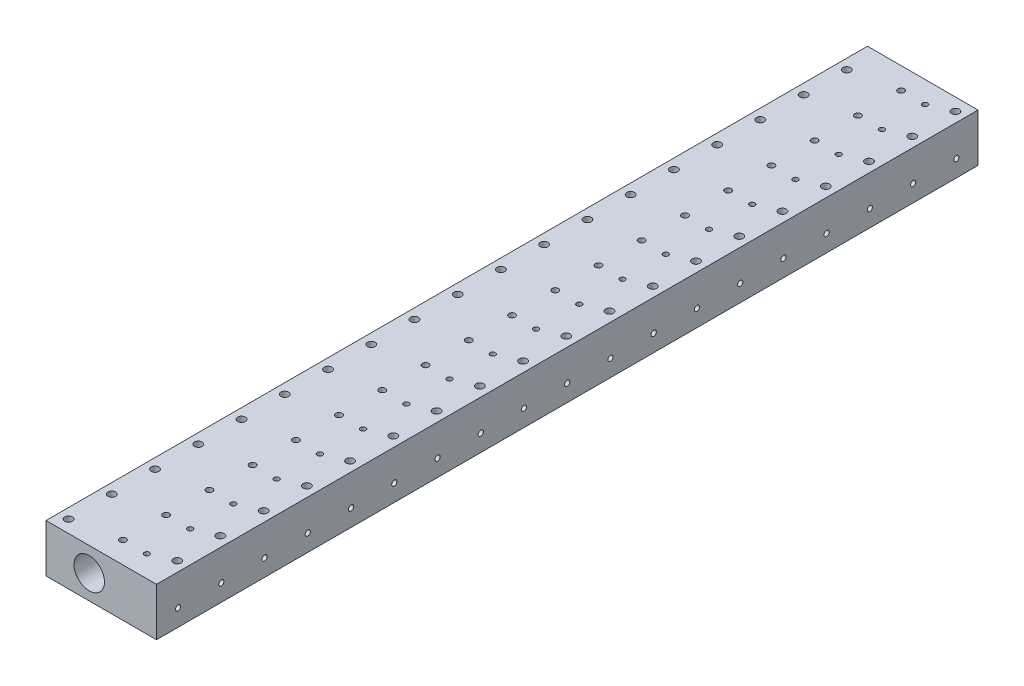
from build123d import *

# Parameters (mm, degrees)
SKETCH1_W                      = 23
SKETCH1_H                      = 10
BOSS_EXTRUDE1_DEPTH            = 171
SKETCH5_R                      = 3.175
CUT_EXTRUDE1_DEPTH             = 172.459178815
M2X0_4_TAPPED_HOLE1_AT_2_COUNT = 2
M2X0_4_TAPPED_HOLE1_AT_2_PITCH = 19.180198122
LPATTERN1_COUNT                = 19
LPATTERN1_PITCH                = 9


with BuildPart() as part:
    # Sketch1 → Boss-Extrude1 (new body)
    with BuildSketch(Plane.XY):
        Rectangle(SKETCH1_W, SKETCH1_H)
    extrude(amount=-BOSS_EXTRUDE1_DEPTH)

    # Sketch4 → #55 (0.052) Diameter Hole1 (revolve, cut)
    with BuildSketch(Plane(origin=(0, 5, -4.5), x_dir=(0, 0, 1), z_dir=(1, 0, 0))):
        Polygon((0, 0), (0, 7.396808353), (0.6604, 7), (0.6604, 0), align=None)
    f_55_0_052_diameter_hole1 = revolve(axis=Axis((0, 11.35, -4.5), (0, -1, 0)), mode=Mode.SUBTRACT)

    # Sketch5 → Cut-Extrude1 (cut, through all)
    with BuildSketch(Plane.XY):
        with Locations((-2.5, 0)):
            Circle(SKETCH5_R)
    extrude(amount=-CUT_EXTRUDE1_DEPTH, mode=Mode.SUBTRACT)

    # Sketch8 → M2x0.4 Tapped Hole1 (revolve, cut)
    with BuildSketch(Plane(origin=(9.4, 5, -6.4), x_dir=(0, 0, 1), z_dir=(1, 0, 0))):
        Polygon((0, 0), (0, 5.680688495), (0.8, 5.2), (0.8, 0), align=None)
    m2x0_4_tapped_hole1 = revolve(axis=Axis((9.4, 11.35, -6.4), (0, -1, 0)), mode=Mode.SUBTRACT)

    # M2x0.4 Tapped Hole1 at 2: M2x0.4 Tapped Hole1 ×2
    with Locations(*[Vector(-0.9801775706589259, 0, 0.1981209983246765) * (i * M2X0_4_TAPPED_HOLE1_AT_2_PITCH) for i in range(1, M2X0_4_TAPPED_HOLE1_AT_2_COUNT)]):
        add(m2x0_4_tapped_hole1, mode=Mode.SUBTRACT)

    # Sketch12 → #57 (0.043) Diameter Hole2 (revolve, cut)
    with BuildSketch(Plane(origin=(11.5, -1.5, -4.5), x_dir=(0, 0, -1), z_dir=(0, 1, 0))):
        Polygon((0, 0), (0, 6.328129984), (0.5461, 6), (0.5461, 0), align=None)
    f_57_0_043_diameter_hole2 = revolve(axis=Axis((17.85, -1.5, -4.5), (-1, 0, 0)), mode=Mode.SUBTRACT)

    # Sketch14 → #57 (0.043) Diameter Hole1 (revolve, cut)
    with BuildSketch(Plane(origin=(5, 5, -4.5), x_dir=(0, 0, 1), z_dir=(1, 0, 0))):
        Polygon((0, 0), (0, 7.828129984), (0.5461, 7.5), (0.5461, 0), align=None)
    f_57_0_043_diameter_hole1 = revolve(axis=Axis((5, 11.35, -4.5), (0, -1, 0)), mode=Mode.SUBTRACT)

    # LPattern1: #55 (0.052) Diameter Hole1, M2x0.4 Tapped Hole1, #57 (0.043) Diameter Hole2, #57 (0.043) Diameter Hole1 ×19
    with Locations(*[(0, 0, -i * LPATTERN1_PITCH) for i in range(1, LPATTERN1_COUNT)]):
        add(f_55_0_052_diameter_hole1, mode=Mode.SUBTRACT)
        add(m2x0_4_tapped_hole1, mode=Mode.SUBTRACT)
        add(f_57_0_043_diameter_hole2, mode=Mode.SUBTRACT)
        add(f_57_0_043_diameter_hole1, mode=Mode.SUBTRACT)

    # LPattern1 copy 1 sketch → LPattern1 copy 1 (revolve, cut)
    with BuildSketch(Plane(origin=(-9.4, 5, -11.6), x_dir=(0, 0, 1), z_dir=(1, 0, 0))):
        Polygon((0, 0), (0, 5.680688495), (0.8, 5.2), (0.8, 0), align=None)
    revolve(axis=Axis((-9.4, 11.35, -11.6), (0, -1, 0)), mode=Mode.SUBTRACT)

    # LPattern1 copy 2 sketch → LPattern1 copy 2 (revolve, cut)
    with BuildSketch(Plane(origin=(-9.4, 5, -20.6), x_dir=(0, 0, 1), z_dir=(1, 0, 0))):
        Polygon((0, 0), (0, 5.680688495), (0.8, 5.2), (0.8, 0), align=None)
    revolve(axis=Axis((-9.4, 11.35, -20.6), (0, -1, 0)), mode=Mode.SUBTRACT)

    # LPattern1 copy 3 sketch → LPattern1 copy 3 (revolve, cut)
    with BuildSketch(Plane(origin=(-9.4, 5, -29.6), x_dir=(0, 0, 1), z_dir=(1, 0, 0))):
        Polygon((0, 0), (0, 5.680688495), (0.8, 5.2), (0.8, 0), align=None)
    revolve(axis=Axis((-9.4, 11.35, -29.6), (0, -1, 0)), mode=Mode.SUBTRACT)

    # LPattern1 copy 4 sketch → LPattern1 copy 4 (revolve, cut)
    with BuildSketch(Plane(origin=(-9.4, 5, -38.6), x_dir=(0, 0, 1), z_dir=(1, 0, 0))):
        Polygon((0, 0), (0, 5.680688495), (0.8, 5.2), (0.8, 0), align=None)
    revolve(axis=Axis((-9.4, 11.35, -38.6), (0, -1, 0)), mode=Mode.SUBTRACT)

    # LPattern1 copy 5 sketch → LPattern1 copy 5 (revolve, cut)
    with BuildSketch(Plane(origin=(-9.4, 5, -47.6), x_dir=(0, 0, 1), z_dir=(1, 0, 0))):
        Polygon((0, 0), (0, 5.680688495), (0.8, 5.2), (0.8, 0), align=None)
    revolve(axis=Axis((-9.4, 11.35, -47.6), (0, -1, 0)), mode=Mode.SUBTRACT)

    # LPattern1 copy 6 sketch → LPattern1 copy 6 (revolve, cut)
    with BuildSketch(Plane(origin=(-9.4, 5, -56.6), x_dir=(0, 0, 1), z_dir=(1, 0, 0))):
        Polygon((0, 0), (0, 5.680688495), (0.8, 5.2), (0.8, 0), align=None)
    revolve(axis=Axis((-9.4, 11.35, -56.6), (0, -1, 0)), mode=Mode.SUBTRACT)

    # LPattern1 copy 7 sketch → LPattern1 copy 7 (revolve, cut)
    with BuildSketch(Plane(origin=(-9.4, 5, -65.6), x_dir=(0, 0, 1), z_dir=(1, 0, 0))):
        Polygon((0, 0), (0, 5.680688495), (0.8, 5.2), (0.8, 0), align=None)
    revolve(axis=Axis((-9.4, 11.35, -65.6), (0, -1, 0)), mode=Mode.SUBTRACT)

    # LPattern1 copy 8 sketch → LPattern1 copy 8 (revolve, cut)
    with BuildSketch(Plane(origin=(-9.4, 5, -74.6), x_dir=(0, 0, 1), z_dir=(1, 0, 0))):
        Polygon((0, 0), (0, 5.680688495), (0.8, 5.2), (0.8, 0), align=None)
    revolve(axis=Axis((-9.4, 11.35, -74.6), (0, -1, 0)), mode=Mode.SUBTRACT)

    # LPattern1 copy 9 sketch → LPattern1 copy 9 (revolve, cut)
    with BuildSketch(Plane(origin=(-9.4, 5, -83.6), x_dir=(0, 0, 1), z_dir=(1, 0, 0))):
        Polygon((0, 0), (0, 5.680688495), (0.8, 5.2), (0.8, 0), align=None)
    revolve(axis=Axis((-9.4, 11.35, -83.6), (0, -1, 0)), mode=Mode.SUBTRACT)

    # LPattern1 copy 10 sketch → LPattern1 copy 10 (revolve, cut)
    with BuildSketch(Plane(origin=(-9.4, 5, -92.6), x_dir=(0, 0, 1), z_dir=(1, 0, 0))):
        Polygon((0, 0), (0, 5.680688495), (0.8, 5.2), (0.8, 0), align=None)
    revolve(axis=Axis((-9.4, 11.35, -92.6), (0, -1, 0)), mode=Mode.SUBTRACT)

    # LPattern1 copy 11 sketch → LPattern1 copy 11 (revolve, cut)
    with BuildSketch(Plane(origin=(-9.4, 5, -101.6), x_dir=(0, 0, 1), z_dir=(1, 0, 0))):
        Polygon((0, 0), (0, 5.680688495), (0.8, 5.2), (0.8, 0), align=None)
    revolve(axis=Axis((-9.4, 11.35, -101.6), (0, -1, 0)), mode=Mode.SUBTRACT)

    # LPattern1 copy 12 sketch → LPattern1 copy 12 (revolve, cut)
    with BuildSketch(Plane(origin=(-9.4, 5, -110.6), x_dir=(0, 0, 1), z_dir=(1, 0, 0))):
        Polygon((0, 0), (0, 5.680688495), (0.8, 5.2), (0.8, 0), align=None)
    revolve(axis=Axis((-9.4, 11.35, -110.6), (0, -1, 0)), mode=Mode.SUBTRACT)

    # LPattern1 copy 13 sketch → LPattern1 copy 13 (revolve, cut)
    with BuildSketch(Plane(origin=(-9.4, 5, -119.6), x_dir=(0, 0, 1), z_dir=(1, 0, 0))):
        Polygon((0, 0), (0, 5.680688495), (0.8, 5.2), (0.8, 0), align=None)
    revolve(axis=Axis((-9.4, 11.35, -119.6), (0, -1, 0)), mode=Mode.SUBTRACT)

    # LPattern1 copy 14 sketch → LPattern1 copy 14 (revolve, cut)
    with BuildSketch(Plane(origin=(-9.4, 5, -128.6), x_dir=(0, 0, 1), z_dir=(1, 0, 0))):
        Polygon((0, 0), (0, 5.680688495), (0.8, 5.2), (0.8, 0), align=None)
    revolve(axis=Axis((-9.4, 11.35, -128.6), (0, -1, 0)), mode=Mode.SUBTRACT)

    # LPattern1 copy 15 sketch → LPattern1 copy 15 (revolve, cut)
    with BuildSketch(Plane(origin=(-9.4, 5, -137.6), x_dir=(0, 0, 1), z_dir=(1, 0, 0))):
        Polygon((0, 0), (0, 5.680688495), (0.8, 5.2), (0.8, 0), align=None)
    revolve(axis=Axis((-9.4, 11.35, -137.6), (0, -1, 0)), mode=Mode.SUBTRACT)

    # LPattern1 copy 16 sketch → LPattern1 copy 16 (revolve, cut)
    with BuildSketch(Plane(origin=(-9.4, 5, -146.6), x_dir=(0, 0, 1), z_dir=(1, 0, 0))):
        Polygon((0, 0), (0, 5.680688495), (0.8, 5.2), (0.8, 0), align=None)
    revolve(axis=Axis((-9.4, 11.35, -146.6), (0, -1, 0)), mode=Mode.SUBTRACT)

    # LPattern1 copy 17 sketch → LPattern1 copy 17 (revolve, cut)
    with BuildSketch(Plane(origin=(-9.4, 5, -155.6), x_dir=(0, 0, 1), z_dir=(1, 0, 0))):
        Polygon((0, 0), (0, 5.680688495), (0.8, 5.2), (0.8, 0), align=None)
    revolve(axis=Axis((-9.4, 11.35, -155.6), (0, -1, 0)), mode=Mode.SUBTRACT)

    # LPattern1 copy 18 sketch → LPattern1 copy 18 (revolve, cut)
    with BuildSketch(Plane(origin=(-9.4, 5, -164.6), x_dir=(0, 0, 1), z_dir=(1, 0, 0))):
        Polygon((0, 0), (0, 5.680688495), (0.8, 5.2), (0.8, 0), align=None)
    revolve(axis=Axis((-9.4, 11.35, -164.6), (0, -1, 0)), mode=Mode.SUBTRACT)


solid = part.part
